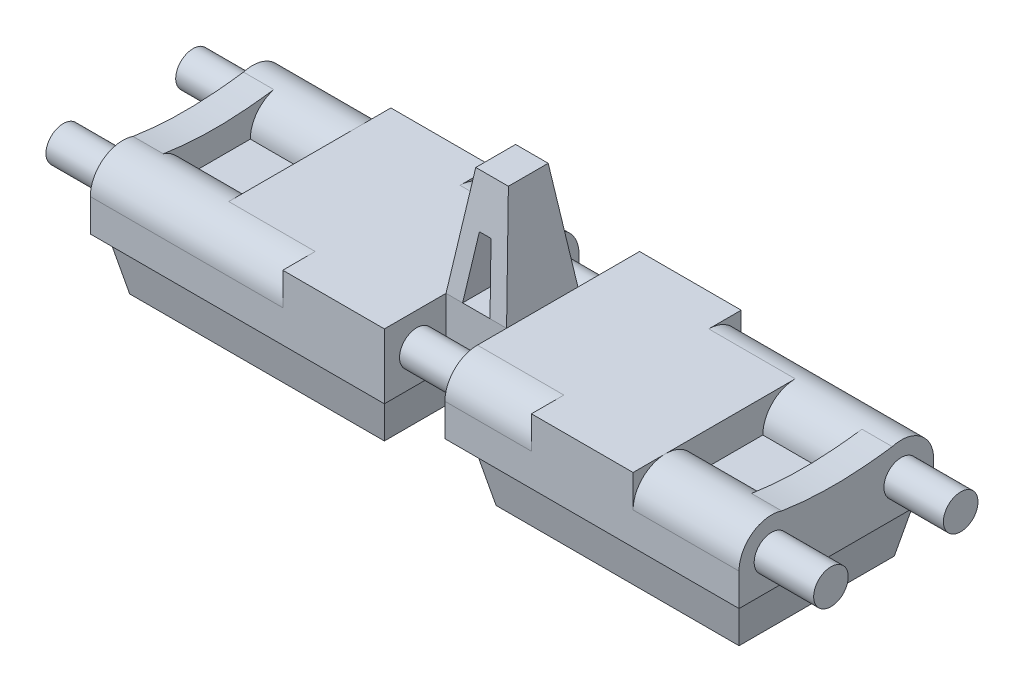
from build123d import *
from build123d.topology import SkipClean

# Parameters (mm, degrees)
ESBO_O2_R                          = 0.75
RESSALTO_EXTRUS_O1_DEPTH           = 7.5
RESSALTO_EXTRUS_O1_2_DEPTH         = 7.5
RESSALTO_EXTRUS_O2_DEPTH           = 0.7
RESSALTO_EXTRUS_O3_START           = -0.7
RESSALTO_EXTRUS_O3_DEPTH           = 0.7
RESSALTO_EXTRUS_O4_DEPTH           = 0.75
RESSALTO_EXTRUS_O4_DEPTH_BACK      = 0.75
ESBO_O5_W                          = 10.1
ESBO_O5_H                          = 4.5
ESBO_O6_W                          = 1.4
ESBO_O6_H                          = 1.425
CORTE_EXTRUS_O1_DEPTH              = 10.75
CORTE_EXTRUS_O4_DEPTH              = 2
CORTE_EXTRUS_O5_DEPTH              = 2
CORTE_EXTRUS_O6_START              = -2
CORTE_EXTRUS_O6_DEPTH              = 2
CORTE_EXTRUS_O7_START              = -2
CORTE_EXTRUS_O7_DEPTH              = 2
RESSALTO_EXTRUS_O6_DEPTH           = 1.65
CORTE_EXTRUS_O8_DEPTH              = 8.2
ESBO_O17_R                         = 0.4
RESSALTO_EXTRUS_O7_DEPTH           = 8.875
ESBO_O18_W                         = 2.45
ESBO_O18_H                         = 4.5
RESSALTO_EXTRUS_O8_DEPTH           = 0.75
ESBO_O14_W                         = 6.4
ESBO_O14_H                         = 4.1
RESSALTO_EXTRUS_O9_DEPTH           = 1.2
RESSALTO_EXTRUS_O9_DRAFT           = 12
ESBO_O14_W_2                       = 6.127542103
RESSALTO_EXTRUS_O9_PROFILE_2_DEPTH = 1.2
RESSALTO_EXTRUS_O9_PROFILE_2_DRAFT = 12


with BuildPart() as part:
    # Esboço2 → Ressalto-extrusão1 (new, symmetric)
    with BuildSketch(Plane(origin=(0, 0, 0), x_dir=(0, 0, -1), z_dir=(1, 0, 0))):
        with Locations((-1.5, 0)):
            Circle(ESBO_O2_R)
    extrude(amount=RESSALTO_EXTRUS_O1_DEPTH, both=True)



with BuildPart() as body_2:
    # Esboço2 → Ressalto-extrus_o1 2 (new, symmetric)
    with BuildSketch(Plane(origin=(0, 0, 0), x_dir=(0, 0, -1), z_dir=(1, 0, 0))):
        with Locations((1.5, 0)):
            Circle(ESBO_O2_R)
    extrude(amount=RESSALTO_EXTRUS_O1_2_DEPTH, both=True)


with BuildPart() as part_1:
    add(part.part)

    add(body_2.part)  # Ressalto-extrusão2 merges body 2
    # Esboço3 → Ressalto-extrusão2 (add)
    with BuildSketch(Plane(origin=(7.5, 0, 0), x_dir=(0, 0, -1), z_dir=(1, 0, 0))):
        with BuildLine():
            ThreePointArc((-1.260740828, 0.710812949), (-2.25, 0), (-1.260740828, -0.710812949))
            add(Edge.make_bspline(
                [(-1.260740828, -0.710812949), (-0.414793738, -0.582924516), (0.318358464, -0.589654398), (1.292699553, -0.720781884)],
                knots=[0.079996458, 0.079996458, 0.079996458, 0.079996458, 0.940072382, 0.940072382, 0.940072382, 0.940072382], degree=3))
            ThreePointArc((1.292699553, -0.720781884), (2.25, 0), (1.292699553, 0.720781884))
            add(Edge.make_bspline(
                [(-1.260740828, 0.710812949), (-0.414793738, 0.582924516), (0.318358464, 0.589654398), (1.292699553, 0.720781884)],
                knots=[0.079996458, 0.079996458, 0.079996458, 0.079996458, 0.940072382, 0.940072382, 0.940072382, 0.940072382], degree=3))
        make_face()
    extrude(amount=-RESSALTO_EXTRUS_O2_DEPTH)

    # Esboço4 → Ressalto-extrusão3 (add)
    with SkipClean():  # the faces are left unmerged after this step: merging them gives an invalid solid
        with BuildSketch(Plane.ZY.offset(7.5).offset(RESSALTO_EXTRUS_O3_START)):
            with BuildLine():
                ThreePointArc((1.260740828, -0.710812949), (2.25, 0), (1.260740828, 0.710812949))
                add(Edge.make_bspline(
                    [(1.260740828, 0.710812949), (0.414793738, 0.582924516), (-0.318358464, 0.589654398), (-1.292699553, 0.720781884)],
                    knots=[0.079996458, 0.079996458, 0.079996458, 0.079996458, 0.940072382, 0.940072382, 0.940072382, 0.940072382], degree=3))
                ThreePointArc((-1.292699553, 0.720781884), (-2.25, 0), (-1.292699553, -0.720781884))
                add(Edge.make_bspline(
                    [(-1.292699553, -0.720781884), (-0.318358464, -0.589654398), (0.414793738, -0.582924516), (1.260740828, -0.710812949)],
                    knots=[0.079996458, 0.079996458, 0.079996458, 0.079996458, 0.940072382, 0.940072382, 0.940072382, 0.940072382], degree=3))
            make_face()
        extrude(amount=RESSALTO_EXTRUS_O3_DEPTH)

    # Esboço5 → Ressalto-extrusão4 (add, two sides: drawn at the far end of the back side and taken through both)
    with SkipClean():  # the faces are left unmerged after this step: merging them gives an invalid solid
        with BuildSketch(Plane(origin=(0, 0, 0), x_dir=(1, 0, 0), z_dir=(0, 1, 0)).offset(-RESSALTO_EXTRUS_O4_DEPTH_BACK)):
            Rectangle(ESBO_O5_W, ESBO_O5_H)
        extrude(amount=RESSALTO_EXTRUS_O4_DEPTH + RESSALTO_EXTRUS_O4_DEPTH_BACK)

    # Esboço6 → Corte-extrusão1 (cut)
    with SkipClean():  # the faces are left unmerged after this step: merging them gives an invalid solid
        with BuildSketch(Plane(origin=(0, 0.75, 0), x_dir=(1, 0, 0), z_dir=(0, 1, 0))):
            with Locations((0, -1.5375)):
                Rectangle(ESBO_O6_W, ESBO_O6_H)
            with Locations((0, 1.5375)):
                Rectangle(ESBO_O6_W, ESBO_O6_H)
        extrude(amount=-CORTE_EXTRUS_O1_DEPTH, mode=Mode.SUBTRACT)

    # Esboço10 → Corte-extrusão4 (cut)
    with SkipClean():  # the faces are left unmerged after this step: merging them gives an invalid solid
        with BuildSketch(Plane(origin=(5.05, 0, 0), x_dir=(0, 0, -1), z_dir=(1, 0, 0))):
            with BuildLine():
                Line((2.25, 0), (2.25, 0.75))
                Line((2.25, 0.75), (1.5, 0.75))
                ThreePointArc((1.5, 0.75), (2.030330086, 0.530330086), (2.25, 0))
            make_face()
        extrude(amount=-CORTE_EXTRUS_O4_DEPTH, mode=Mode.SUBTRACT)

    # Esboço11 → Corte-extrusão5 (cut)
    with SkipClean():  # the faces are left unmerged after this step: merging them gives an invalid solid
        with BuildSketch(Plane(origin=(-0.7, 0, 0), x_dir=(0, 0, -1), z_dir=(1, 0, 0))):
            with BuildLine():
                Line((2.25, 0), (2.25, 0.75))
                Line((2.25, 0.75), (1.5, 0.75))
                ThreePointArc((1.5, 0.75), (2.030330086, 0.530330086), (2.25, 0))
            make_face()
        extrude(amount=-CORTE_EXTRUS_O5_DEPTH, mode=Mode.SUBTRACT)

    # Esboço12 → Corte-extrusão6 (cut)
    with SkipClean():  # the faces are left unmerged after this step: merging them gives an invalid solid
        with BuildSketch(Plane.ZY.offset(5.05).offset(CORTE_EXTRUS_O6_START)):
            with BuildLine():
                Line((2.25, 0), (2.25, 0.75))
                Line((2.25, 0.75), (1.5, 0.75))
                ThreePointArc((1.5, 0.75), (2.030330086, 0.530330086), (2.25, 0))
            make_face()
        extrude(amount=CORTE_EXTRUS_O6_DEPTH, mode=Mode.SUBTRACT)

    # Esboço13 → Corte-extrusão7 (cut)
    with SkipClean():  # the faces are left unmerged after this step: merging them gives an invalid solid
        with BuildSketch(Plane.ZY.offset(-0.7).offset(CORTE_EXTRUS_O7_START)):
            with BuildLine():
                Line((2.25, 0), (2.25, 0.75))
                Line((2.25, 0.75), (1.5, 0.75))
                ThreePointArc((1.5, 0.75), (2.030330086, 0.530330086), (2.25, 0))
            make_face()
        extrude(amount=CORTE_EXTRUS_O7_DEPTH, mode=Mode.SUBTRACT)

    # Esboço15 → Ressalto-extrusão6 (add)
    with SkipClean():  # the faces are left unmerged after this step: merging them gives an invalid solid
        with BuildSketch(Plane.XY.offset(0.825)):
            Polygon((-0.7, 0.75), (-0.377007733, 3.25), (0.377007733, 3.25), (0.7, 0.75), (0.316841675, 0.75), (0.134253605, 2.163254196), (-0.134253605, 2.163254196), (-0.316841675, 0.75), align=None)
        extrude(amount=-RESSALTO_EXTRUS_O6_DEPTH)

    # Esboço16 → Corte-extrusão8 (cut)
    with SkipClean():  # the faces are left unmerged after this step: merging them gives an invalid solid
        with BuildSketch(Plane(origin=(5.05, 0, 0), x_dir=(0, 0, -1), z_dir=(1, 0, 0))):
            Polygon((-0.46047459, 3.25), (0.46047459, 3.25), (0.825, 0.75), (1.700771093, 3.688563276), (-1.641477372, 3.918008251), (-0.825, 0.75), align=None)
        extrude(amount=-CORTE_EXTRUS_O8_DEPTH, mode=Mode.SUBTRACT)

    # Esboço17 → Ressalto-extrusão7 (add, symmetric)
    with SkipClean():  # the faces are left unmerged after this step: merging them gives an invalid solid
        with BuildSketch(Plane(origin=(0, 0, 0), x_dir=(0, 0, -1), z_dir=(1, 0, 0))):
            with Locations(Location((-1.5, 0, 0), (0, 0, 180))):
                Circle(ESBO_O17_R)
            with Locations(Location((1.5, 0, 0), (0, 0, 180))):
                Circle(ESBO_O17_R)
        extrude(amount=RESSALTO_EXTRUS_O7_DEPTH, both=True)

    # Esboço18 → Ressalto-extrusão8 (add)
    with SkipClean():  # the faces are left unmerged after this step: merging them gives an invalid solid
        with BuildSketch(Plane(origin=(0, 0, 0), x_dir=(1, 0, 0), z_dir=(0, 1, 0))):
            with Locations((6.275, 0)):
                Rectangle(ESBO_O18_W, ESBO_O18_H)
            with Locations((-6.275, 0)):
                Rectangle(ESBO_O18_W, ESBO_O18_H)
        extrude(amount=-RESSALTO_EXTRUS_O8_DEPTH)


with BuildPart() as body_2_2:
    # Esboço14 → Ressalto-extrusão9 (with draft: the straight prism first)
    with BuildSketch(Plane.XZ.offset(0.75)):
        with Locations((-4.1, 0)):
            Rectangle(ESBO_O14_W, ESBO_O14_H)
    extrude(amount=RESSALTO_EXTRUS_O9_DEPTH)
    # Ressalto-extrusão9: the draft: its side faces are tilted about the plane it starts from
    ressalto_extrus_o9_sides = [body_2_2.faces().sort_by_distance(p)[0] for p in [
        (-4.1, -1.35, 2.05),
        (-7.3, -1.35, 0),
        (-4.1, -1.35, -2.05),
        (-0.9, -1.35, 0),
    ]]
    draft(ressalto_extrus_o9_sides, Plane.XZ.offset(0.75), RESSALTO_EXTRUS_O9_DRAFT)


with BuildPart() as body_3:
    # Esboço14 → Ressalto-extrusão9 profile 2 (with draft: the straight prism first)
    with BuildSketch(Plane.XZ.offset(0.75)):
        with Locations((4.236228949, 0)):
            Rectangle(ESBO_O14_W_2, ESBO_O14_H)
    extrude(amount=RESSALTO_EXTRUS_O9_PROFILE_2_DEPTH)
    # Ressalto-extrusão9 profile 2: the draft: its side faces are tilted about the plane it starts from
    ressalto_extrus_o9_profile_2_sides = [body_3.faces().sort_by_distance(p)[0] for p in [
        (4.236228948, -1.35, 2.05),
        (1.172457897, -1.35, 0),
        (4.236228948, -1.35, -2.05),
        (7.3, -1.35, 0),
    ]]
    draft(ressalto_extrus_o9_profile_2_sides, Plane.XZ.offset(0.75), RESSALTO_EXTRUS_O9_PROFILE_2_DRAFT)


solid = Compound([part_1.part, body_2_2.part, body_3.part])
